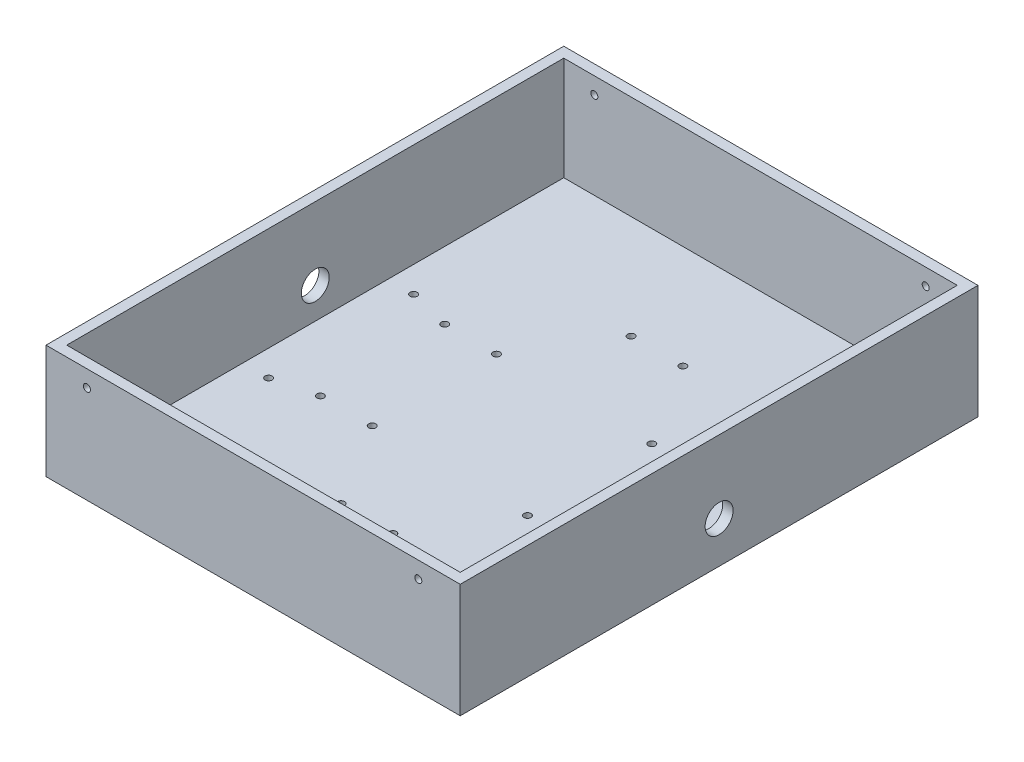
from build123d import *

# Parameters (mm, degrees)
SKETCH1_W               = 190
SKETCH1_H               = 50
BOSS_EXTRUDE1_DEPTH     = 120
SHELL1_T                = 5
CUT_EXTRUDE1_DEPTH      = 168.705098312
CUT_EXTRUDE1_DEPTH_BACK = 168.705098312
SKETCH2_R               = 1.7
CUT_EXTRUDE2_DEPTH      = 168.705098312
CUT_EXTRUDE2_DEPTH_BACK = 168.705098312
SKETCH3_R               = 6.75
M3_CLEARANCE_HOLE1_D    = 3.4


with BuildPart() as part:
    # Sketch1 → Boss-Extrude1 (new, symmetric)
    with BuildSketch(Plane.XY):
        with Locations((0, 25)):
            Rectangle(SKETCH1_W, SKETCH1_H)
    extrude(amount=BOSS_EXTRUDE1_DEPTH, both=True)

    # Shell1
    shell1_openings = [part.faces().sort_by_distance(p)[0] for p in [
        (0, 50, 0),
    ]]
    offset(amount=SHELL1_T, openings=shell1_openings, kind=Kind.INTERSECTION)

    # Sketch2 → Cut-Extrude1 (cut, two sides: drawn at the far end of the back side and taken through both)
    with BuildSketch(Plane(origin=(0, 0, 0), x_dir=(1, 0, 0), z_dir=(0, 1, 0)).offset(-CUT_EXTRUDE1_DEPTH_BACK)):
        with Locations((-12.5, 70)):
            Circle(SKETCH2_R)
        with Locations((-37.5, 30)):
            Circle(SKETCH2_R)
        with Locations((-62.5, 30)):
            Circle(SKETCH2_R)
        with Locations((-82.5, 35)):
            Circle(SKETCH2_R)
        with Locations((82.5, 35)):
            Circle(SKETCH2_R)
        with Locations((62.5, 30)):
            Circle(SKETCH2_R)
        with Locations((37.5, 30)):
            Circle(SKETCH2_R)
        with Locations((12.5, 70)):
            Circle(SKETCH2_R)
        with Locations((12.5, -70)):
            Circle(SKETCH2_R)
        with Locations((37.5, -30)):
            Circle(SKETCH2_R)
        with Locations((62.5, -30)):
            Circle(SKETCH2_R)
        with Locations((82.5, -35)):
            Circle(SKETCH2_R)
        with Locations((-82.5, -35)):
            Circle(SKETCH2_R)
        with Locations((-62.5, -30)):
            Circle(SKETCH2_R)
        with Locations((-37.5, -30)):
            Circle(SKETCH2_R)
        with Locations((-12.5, -70)):
            Circle(SKETCH2_R)
    extrude(amount=CUT_EXTRUDE1_DEPTH + CUT_EXTRUDE1_DEPTH_BACK, mode=Mode.SUBTRACT)

    # Sketch3 → Cut-Extrude2 (cut, two sides: drawn at the far end of the back side and taken through both)
    with BuildSketch(Plane(origin=(0, 0, 0), x_dir=(0, 0, -1), z_dir=(1, 0, 0)).offset(-CUT_EXTRUDE2_DEPTH_BACK)):
        with Locations((0, 15)):
            Circle(SKETCH3_R)
    extrude(amount=CUT_EXTRUDE2_DEPTH + CUT_EXTRUDE2_DEPTH_BACK, mode=Mode.SUBTRACT)

    # M3 Clearance Hole1 (through all)
    with Locations(Plane.XY.offset(125)):
        with Locations((-80.25, 42), (79.75, 42)):
            Hole(M3_CLEARANCE_HOLE1_D / 2)


solid = part.part
